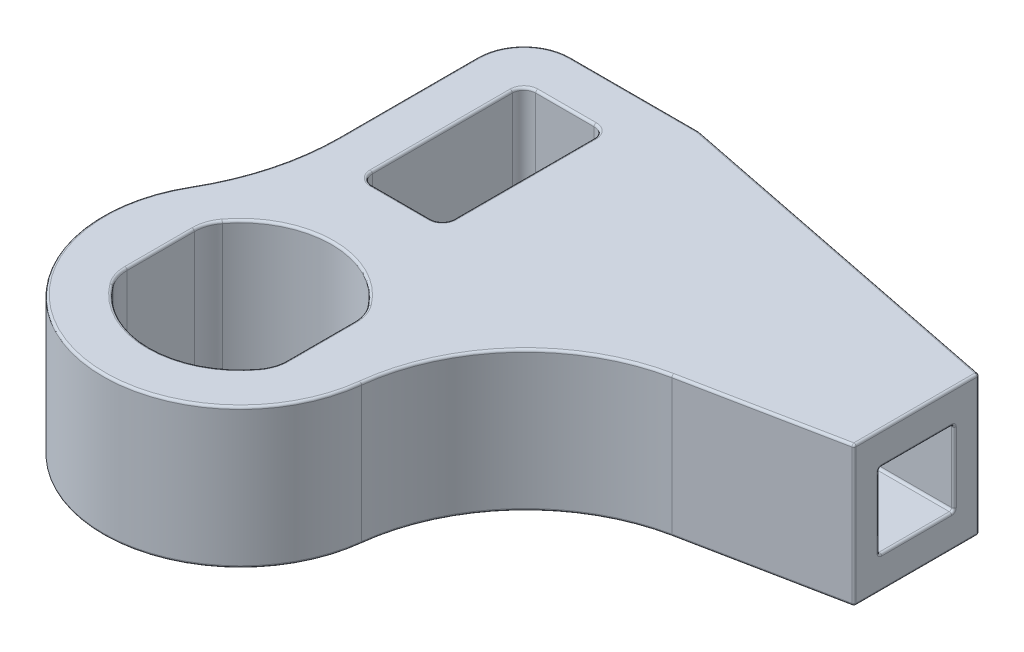
from build123d import *
from OCP.BRepFilletAPI import BRepFilletAPI_MakeChamfer

# Parameters (mm, degrees)
ESQUISSE1_R        = 5.9
ESQUISSE1_R_2      = 3.9
BOSS_EXTRU_1_DEPTH = 6
ESQUISSE3_W        = 11.345057629
ESQUISSE3_H        = 6
ESQUISSE3_W_2      = 3.2
ESQUISSE3_H_2      = 3.2
BOSS_EXTRU_2_DEPTH = 15
CHANFREIN1_SIZE    = 3
CHANFREIN1_SIZE_2  = 15
CONG_1_DEPTH       = 6
CONG_2_R           = 10
CONG_3_R           = 2
CONG_4_R           = 1.5
CONG_5_R           = 0.5
CONG_6_R           = 0.1
CONG_7_R           = 0.1


with BuildPart() as part:
    # Esquisse1 → Boss.-Extru.1 (new body)
    # profile 1 of 5: a face of its own
    with BuildSketch(Plane(origin=(0, 0, 0), x_dir=(1, 0, 0), z_dir=(0, 1, 0))):
        Circle(ESQUISSE1_R)
        Circle(ESQUISSE1_R_2, mode=Mode.SUBTRACT)
    # profile 2 of 5: a face of its own
    with BuildSketch(Plane(origin=(0, 0, 0), x_dir=(1, 0, 0), z_dir=(0, 1, 0))):
        with BuildLine():
            Line((-3.75, 12.9), (-3.75, 4.554942371))
            ThreePointArc((-3.75, 4.554942371), (0, 5.9), (3.75, 4.554942371))
            Line((3.75, 4.554942371), (3.75, 12.9))
            Line((3.75, 12.9), (3.75, 15.9))
            Line((3.75, 15.9), (0, 15.9))
            Line((0, 15.9), (-3.75, 15.9))
            Line((-3.75, 15.9), (-3.75, 12.9))
        make_face()
        Polygon((-1.75, 13.9), (0, 13.9), (1.75, 13.9), (1.75, 6.9), (-1.75, 6.9), align=None, mode=Mode.SUBTRACT)
    # profile 3 of 5: a face of its own
    with BuildSketch(Plane(origin=(0, 0, 0), x_dir=(1, 0, 0), z_dir=(0, 1, 0))):
        with BuildLine():
            ThreePointArc((3.75, 4.554942371), (0, 5.9), (-3.75, 4.554942371))
            ThreePointArc((-3.75, 4.554942371), (-2.518432052, -5.335494354), (5.9, 0))
            ThreePointArc((5.9, 0), (5.335494354, 2.518432052), (3.75, 4.554942371))
        make_face()
        with BuildLine():
            ThreePointArc((-3.42, 1.874459922), (0, 3.9), (3.42, 1.874459922))
            ThreePointArc((3.42, 1.874459922), (3.778094758, 0.96747093), (3.9, 0))
            ThreePointArc((3.9, 0), (3.778094758, -0.96747093), (3.42, -1.874459922))
            ThreePointArc((3.42, -1.874459922), (0, -3.9), (-3.42, -1.874459922))
            ThreePointArc((-3.42, -1.874459922), (-3.9, 0), (-3.42, 1.874459922))
        make_face(mode=Mode.SUBTRACT)
    # profile 4 of 5: a face of its own
    with BuildSketch(Plane(origin=(0, 0, 0), x_dir=(1, 0, 0), z_dir=(0, 1, 0))):
        with BuildLine():
            ThreePointArc((3.9, 0), (3.778094758, 0.96747093), (3.42, 1.874459922))
            Line((3.42, 1.874459922), (3.42, -1.874459922))
            ThreePointArc((3.42, -1.874459922), (3.778094758, -0.96747093), (3.9, 0))
        make_face()
    # profile 5 of 5: a face of its own
    with BuildSketch(Plane(origin=(0, 0, 0), x_dir=(1, 0, 0), z_dir=(0, 1, 0))):
        with BuildLine():
            Line((-3.42, -1.874459922), (-3.42, 1.874459922))
            ThreePointArc((-3.42, 1.874459922), (-3.9, 0), (-3.42, -1.874459922))
        make_face()
    extrude(amount=BOSS_EXTRU_1_DEPTH)

    # Esquisse3 → Boss.-Extru.2 (add)
    with BuildSketch(Plane(origin=(3.75, 0, 0), x_dir=(0, 0, -1), z_dir=(1, 0, 0))):
        with Locations((10.227471186, 3)):
            Rectangle(ESQUISSE3_W, ESQUISSE3_H)
        with Locations((10.227471185, 3)):
            Rectangle(ESQUISSE3_W_2, ESQUISSE3_H_2, mode=Mode.SUBTRACT)
    extrude(amount=BOSS_EXTRU_2_DEPTH)

    # Chanfrein1
    chanfrein1_edges_1 = [part.edges().sort_by_distance(p)[0] for p in [
        (18.75, 3, -15.9),
    ]]
    chanfrein1_side_1 = [part.faces().sort_by_distance(p)[0] for p in [
        (18.75, 3, -15.84),
    ]]
    chanfrein1_edges_2 = [part.edges().sort_by_distance(p)[0] for p in [
        (18.75, 3, -4.554942371),
    ]]
    chanfrein1_side_2 = [part.faces().sort_by_distance(p)[0] for p in [
        (18.69, 3, -4.554942371),
    ]]
    chanfrein1 = BRepFilletAPI_MakeChamfer(part.part.solid().wrapped)
    for e in chanfrein1_edges_1:
        chanfrein1.Add(CHANFREIN1_SIZE - 0.0001, CHANFREIN1_SIZE_2 - 0.0001, e.wrapped, chanfrein1_side_1[0].wrapped)
    for e in chanfrein1_edges_2:
        chanfrein1.Add(CHANFREIN1_SIZE_2 - 0.0001, CHANFREIN1_SIZE - 0.0001, e.wrapped, chanfrein1_side_2[0].wrapped)
    add(Compound.cast(chanfrein1.Shape()), mode=Mode.REPLACE)  # a hair under: the kernel refuses the full size

    # Congé1: read off the stored shape, not the designer's step
    # Congé1 outline → Congé1 (add)
    with BuildSketch(Plane(origin=(0, 0, 0), x_dir=(1, 0, 0), z_dir=(0, 1, 0))):
        with BuildLine():
            ThreePointArc((3.75, 4.554942371), (5.471150644, 2.208282282), (5.861186035, -0.67564655))
            ThreePointArc((5.861186035, -0.67564655), (7.92289048, 3.826610711), (12.239627849, 6.252867941))
            Line((12.239627849, 6.252867941), (3.75, 4.554942371))
        make_face()
    extrude(amount=CONG_1_DEPTH)

    # Congé2
    cong_2_edges = [part.edges().sort_by_distance(p)[0] for p in [
        (-3.75, 3, -4.554942371),
    ]]
    fillet(cong_2_edges, radius=CONG_2_R)

    # Congé3
    cong_3_edges = [part.edges().sort_by_distance(p)[0] for p in [
        (-3.75, 3, -15.9),
    ]]
    fillet(cong_3_edges, radius=CONG_3_R)

    # Congé4
    cong_4_edges = [part.edges().sort_by_distance(p)[0] for p in [
        (3.42, 3, 1.874459922),
        (3.42, 3, -1.874459922),
        (-3.42, 3, -1.874459922),
        (-3.42, 3, 1.874459922),
    ]]
    fillet(cong_4_edges, radius=CONG_4_R)

    # Congé5
    cong_5_edges = [part.edges().sort_by_distance(p)[0] for p in [
        (-1.75, 3, -6.9),
        (1.75, 3, -6.9),
        (1.75, 3, -13.9),
        (-1.75, 3, -13.9),
    ]]
    fillet(cong_5_edges, radius=CONG_5_R)

    # Congé6
    cong_6_edges = [part.edges().sort_by_distance(p)[0] for p in [
        (11.25, 4.6, -11.827471185),
        (11.25, 4.6, -8.627471185),
        (11.25, 1.4, -8.627471185),
        (11.25, 1.4, -11.827471185),
    ]]
    fillet(cong_6_edges, radius=CONG_6_R)

    # Congé7
    cong_7_edges = [part.edges().sort_by_distance(p)[0] for p in [
        (-3.164213562, 0, -15.314213562),
        (-3.164213562, 6, -15.314213562),
        (0, 0, 3.9),
        (0, 6, 3.9),
        (3.42, 0, 0),
        (3.42, 6, 0),
        (0, 0, -3.9),
        (0, 6, -3.9),
        (-3.42, 0, 0),
        (-3.42, 6, 0),
        (3.343024947, 0, 1.914341649),
        (3.343024947, 6, 1.914341649),
        (3.343024947, 0, -1.914341649),
        (3.343024947, 6, -1.914341649),
        (-3.343024947, 0, 1.914341649),
        (-3.343024947, 6, 1.914341649),
        (-3.343024947, 0, -1.914341649),
        (-3.343024947, 6, -1.914341649),
        (0, 0, -13.9),
        (0, 6, -13.9),
        (-1.75, 0, -10.4),
        (-1.75, 6, -10.4),
        (1.75, 0, -10.4),
        (1.75, 6, -10.4),
        (0, 0, -6.9),
        (0, 6, -6.9),
        (-1.603553391, 0, -13.753553391),
        (-1.603553391, 6, -13.753553391),
        (1.603553391, 0, -13.753553391),
        (1.603553391, 6, -13.753553391),
        (-1.603553391, 0, -7.046446609),
        (-1.603553391, 6, -7.046446609),
        (1.603553391, 0, -7.046446609),
        (1.603553391, 6, -7.046446609),
        (3.75, 3, -11.827471185),
        (18.75, 3, -11.827471185),
        (3.75, 1.4, -10.227471185),
        (3.75, 4.6, -10.227471185),
        (3.75, 3, -8.627471185),
        (3.75, 4.570710678, -8.656760507),
        (3.75, 1.429289322, -8.656760507),
        (3.75, 1.429289322, -11.798181863),
        (3.75, 4.570710678, -11.798181863),
        (18.75, 4.6, -10.227471185),
        (18.75, 1.4, -10.227471185),
        (18.75, 3, -8.627471185),
        (18.75, 4.570710678, -11.798181863),
        (18.75, 1.429289322, -11.798181863),
        (18.75, 1.429289322, -8.656760507),
        (18.75, 4.570710678, -8.656760507),
        (18.75, 0, -10.227471185),
        (18.75, 6, -10.227471185),
        (18.75, 3, -7.554842371),
        (18.75, 3, -12.9001),
        (1.00005, 6, -15.9),
        (11.25005, 6, -14.40005),
        (1.00005, 0, -15.9),
        (3.7501, 3, -15.9),
        (15.479149713, 0, -6.900689758),
        (11.25005, 0, -14.40005),
        (15.479149713, 6, -6.900689758),
        (7.912078424, 0, -3.814842663),
        (7.912078424, 6, -3.814842663),
        (-1.858330123, 0, 5.599697238),
        (-1.858330123, 6, 5.599697238),
        (-3.75, 0, -10.942101577),
        (-3.75, 6, -10.942101577),
        (-4.093965943, 0, -5.384009644),
        (-4.093965943, 6, -5.384009644),
    ]]
    fillet(cong_7_edges, radius=CONG_7_R)


solid = part.part
